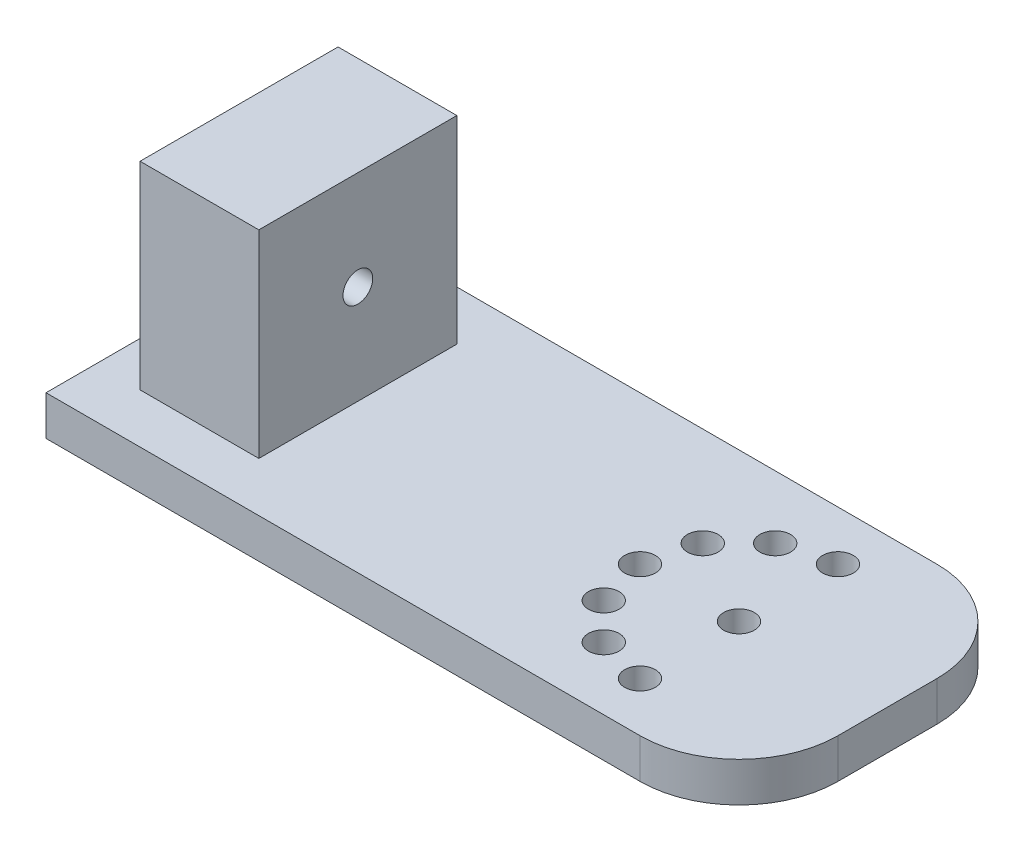
from build123d import *

# Parameters (mm, degrees)
SKETCH_1_W          = 70
SKETCH_1_H          = 30
EXTRUDE_1_DEPTH     = 4
SKETCH_2_W          = 12
SKETCH_2_H          = 20
EXTRUDE_2_DEPTH     = 20
SKETCH_7_R          = 1.5
CUT_EXTRUDE_2_DEPTH = 12
SKETCH_11_R         = 1.55
CUT_EXTRUDE_4_DEPTH = 50
FILLET_1_R          = 10
FILLET_2_R          = 10


with BuildPart() as part:
    # 草图1 → 凸台-拉伸1 (new body)
    with BuildSketch(Plane(origin=(0, 0, 0), x_dir=(1, 0, 0), z_dir=(0, 1, 0))):
        with Locations((35, -15)):
            Rectangle(SKETCH_1_W, SKETCH_1_H)
    extrude(amount=EXTRUDE_1_DEPTH)

    # 草图2 → 凸台-拉伸2 (add)
    with BuildSketch(Plane(origin=(0, 4, 0), x_dir=(1, 0, 0), z_dir=(0, 1, 0))):
        with Locations((10.5, -15)):
            Rectangle(SKETCH_2_W, SKETCH_2_H)
    extrude(amount=EXTRUDE_2_DEPTH)

    # 草图7 → 切除-拉伸2 (cut)
    with BuildSketch(Plane(origin=(16.5, 0, 0), x_dir=(0, 0, -1), z_dir=(1, 0, 0))):
        with Locations((-15, 14)):
            Circle(SKETCH_7_R)
    extrude(amount=-CUT_EXTRUDE_2_DEPTH, mode=Mode.SUBTRACT)

    # 草图11 → 切除-拉伸4 (cut)
    with BuildSketch(Plane(origin=(0, 4, 0), x_dir=(1, 0, 0), z_dir=(0, 1, 0))):
        with Locations((55, -15)):
            Circle(SKETCH_11_R)
        with Locations((50, -23.660254038)):
            Circle(SKETCH_11_R)
        with Locations((46.339745962, -20)):
            Circle(SKETCH_11_R)
        with Locations((46.339745962, -10)):
            Circle(SKETCH_11_R)
        with Locations((50, -6.339745962)):
            Circle(SKETCH_11_R)
        with Locations((45, -15)):
            Circle(SKETCH_11_R)
        with Locations((55, -5)):
            Circle(SKETCH_11_R)
        with Locations((55, -25)):
            Circle(SKETCH_11_R)
    extrude(amount=-CUT_EXTRUDE_4_DEPTH, mode=Mode.SUBTRACT)

    # 圆角1
    fillet_1_edges = [part.edges().sort_by_distance(p)[0] for p in [
        (70, 2, 30),
    ]]
    fillet(fillet_1_edges, radius=FILLET_1_R)

    # 圆角2
    fillet_2_edges = [part.edges().sort_by_distance(p)[0] for p in [
        (70, 2, 0),
    ]]
    fillet(fillet_2_edges, radius=FILLET_2_R)


solid = part.part
